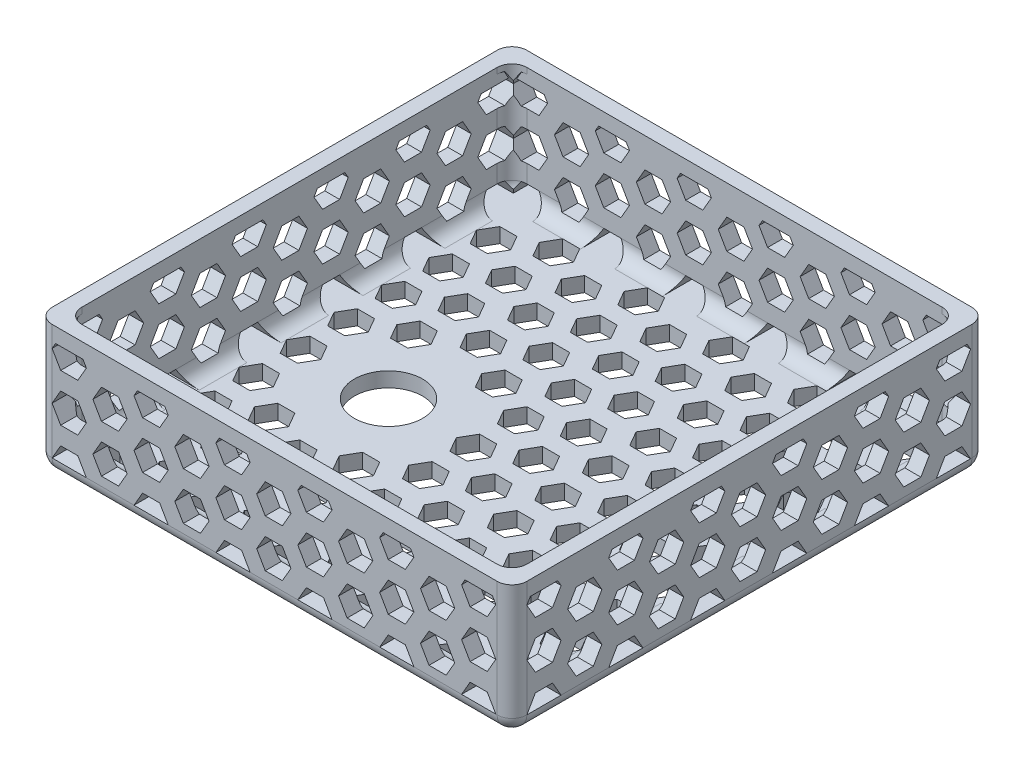
from build123d import *

# Parameters (mm, degrees)
SKETCH1_W           = 80
SKETCH1_H           = 80
BOSS_EXTRUDE1_DEPTH = 22
SKETCH2_W           = 75
SKETCH2_H           = 75
CUT_EXTRUDE1_DEPTH  = 19.5
FILLET1_R           = 2.5
SKETCH10_R          = 5.75
CUT_EXTRUDE5_DEPTH  = 2.5
CUT_EXTRUDE6_DEPTH  = 5
SKETCH12_W          = 75
SKETCH12_H          = 2.5
BOSS_EXTRUDE2_DEPTH = 2.5
CIRPATTERN9_COUNT   = 4


with BuildPart() as part:
    # Sketch1 → Boss-Extrude1 (new body)
    with BuildSketch(Plane(origin=(0, 0, 0), x_dir=(1, 0, 0), z_dir=(0, 1, 0))):
        with Locations((40, 40)):
            Rectangle(SKETCH1_W, SKETCH1_H)
    extrude(amount=BOSS_EXTRUDE1_DEPTH)

    # Sketch2 → Cut-Extrude1 (cut)
    with BuildSketch(Plane(origin=(0, 22, 0), x_dir=(1, 0, 0), z_dir=(0, 1, 0))):
        with Locations((40, 40)):
            Rectangle(SKETCH2_W, SKETCH2_H)
    extrude(amount=-CUT_EXTRUDE1_DEPTH, mode=Mode.SUBTRACT)

    # Fillet1
    fillet1_edges = [part.edges().sort_by_distance(p)[0] for p in [
        (2.5, 2.5, -40),
        (2.5, 12.25, -2.5),
        (40, 2.5, -77.5),
        (2.5, 12.25, -77.5),
        (77.5, 2.5, -40),
        (77.5, 12.25, -77.5),
        (40, 2.5, -2.5),
        (77.5, 12.25, -2.5),
        (40, 0, -80),
        (80, 0, -40),
        (40, 0, 0),
        (0, 0, -40),
        (0, 11, -80),
        (80, 11, -80),
        (80, 11, 0),
        (0, 11, 0),
    ]]
    fillet(fillet1_edges, radius=FILLET1_R)

    # Sketch10 → Cut-Extrude5 (cut)
    with BuildSketch(Plane(origin=(0, 2.5, 0), x_dir=(1, 0, 0), z_dir=(0, 1, 0))):
        with Locations(Location((22.186751346, 37, 0), (0, 0, 270))):
            Circle(SKETCH10_R)
        Polygon((10.773502692, 5), (9.330127019, 7.5), (6.443375673, 7.5), (5, 5), align=None)
        Polygon((25.073502692, 5), (23.630127019, 7.5), (20.743375673, 7.5), (19.3, 5), align=None)
        Polygon((13.526497308, 6), (16.413248654, 6), (17.856624327, 8.5), (16.413248654, 11), (13.526497308, 11), (12.083121635, 8.5), align=None)
        Polygon((39.373502692, 5), (37.930127019, 7.5), (35.043375673, 7.5), (33.6, 5), align=None)
        Polygon((27.826497308, 6), (30.713248654, 6), (32.156624327, 8.5), (30.713248654, 11), (27.826497308, 11), (26.383121635, 8.5), align=None)
        Polygon((53.673502692, 5), (52.230127019, 7.5), (49.343375673, 7.5), (47.9, 5), align=None)
        Polygon((42.126497308, 6), (45.013248654, 6), (46.456624327, 8.5), (45.013248654, 11), (42.126497308, 11), (40.683121635, 8.5), align=None)
        Polygon((67.973502692, 5), (66.530127019, 7.5), (63.643375673, 7.5), (62.2, 5), align=None)
        Polygon((56.426497308, 6), (59.313248654, 6), (60.756624327, 8.5), (59.313248654, 11), (56.426497308, 11), (54.983121635, 8.5), align=None)
        Polygon((70.726497308, 6), (73.613248654, 6), (75.056624327, 8.5), (73.613248654, 11), (70.726497308, 11), (69.283121635, 8.5), align=None)
        Polygon((23.630127019, 10.5), (25.073502692, 13), (23.630127019, 15.5), (20.743375673, 15.5), (19.3, 13), (20.743375673, 10.5), align=None)
        Polygon((13.526497308, 14), (16.413248654, 14), (17.856624327, 16.5), (16.413248654, 19), (13.526497308, 19), (12.083121635, 16.5), align=None)
        Polygon((37.930127019, 10.5), (39.373502692, 13), (37.930127019, 15.5), (35.043375673, 15.5), (33.6, 13), (35.043375673, 10.5), align=None)
        Polygon((27.826497308, 14), (30.713248654, 14), (32.156624327, 16.5), (30.713248654, 19), (27.826497308, 19), (26.383121635, 16.5), align=None)
        Polygon((52.230127019, 10.5), (53.673502692, 13), (52.230127019, 15.5), (49.343375673, 15.5), (47.9, 13), (49.343375673, 10.5), align=None)
        Polygon((42.126497308, 14), (45.013248654, 14), (46.456624327, 16.5), (45.013248654, 19), (42.126497308, 19), (40.683121635, 16.5), align=None)
        Polygon((66.530127019, 10.5), (67.973502692, 13), (66.530127019, 15.5), (63.643375673, 15.5), (62.2, 13), (63.643375673, 10.5), align=None)
        Polygon((56.426497308, 14), (59.313248654, 14), (60.756624327, 16.5), (59.313248654, 19), (56.426497308, 19), (54.983121635, 16.5), align=None)
        Polygon((70.726497308, 14), (73.613248654, 14), (75.056624327, 16.5), (73.613248654, 19), (70.726497308, 19), (69.283121635, 16.5), align=None)
        Polygon((23.630127019, 18.5), (25.073502692, 21), (23.630127019, 23.5), (20.743375673, 23.5), (19.3, 21), (20.743375673, 18.5), align=None)
        Polygon((13.526497308, 22), (16.413248654, 22), (17.856624327, 24.5), (16.413248654, 27), (13.526497308, 27), (12.083121635, 24.5), align=None)
        Polygon((37.930127019, 18.5), (39.373502692, 21), (37.930127019, 23.5), (35.043375673, 23.5), (33.6, 21), (35.043375673, 18.5), align=None)
        Polygon((27.826497308, 22), (30.713248654, 22), (32.156624327, 24.5), (30.713248654, 27), (27.826497308, 27), (26.383121635, 24.5), align=None)
        Polygon((52.230127019, 18.5), (53.673502692, 21), (52.230127019, 23.5), (49.343375673, 23.5), (47.9, 21), (49.343375673, 18.5), align=None)
        Polygon((42.126497308, 22), (45.013248654, 22), (46.456624327, 24.5), (45.013248654, 27), (42.126497308, 27), (40.683121635, 24.5), align=None)
        Polygon((66.530127019, 18.5), (67.973502692, 21), (66.530127019, 23.5), (63.643375673, 23.5), (62.2, 21), (63.643375673, 18.5), align=None)
        Polygon((56.426497308, 22), (59.313248654, 22), (60.756624327, 24.5), (59.313248654, 27), (56.426497308, 27), (54.983121635, 24.5), align=None)
        Polygon((70.726497308, 22), (73.613248654, 22), (75.056624327, 24.5), (73.613248654, 27), (70.726497308, 27), (69.283121635, 24.5), align=None)
        Polygon((37.930127019, 26.5), (39.373502692, 29), (37.930127019, 31.5), (35.043375673, 31.5), (33.6, 29), (35.043375673, 26.5), align=None)
        Polygon((52.230127019, 26.5), (53.673502692, 29), (52.230127019, 31.5), (49.343375673, 31.5), (47.9, 29), (49.343375673, 26.5), align=None)
        Polygon((42.126497308, 30), (45.013248654, 30), (46.456624327, 32.5), (45.013248654, 35), (42.126497308, 35), (40.683121635, 32.5), align=None)
        Polygon((66.530127019, 26.5), (67.973502692, 29), (66.530127019, 31.5), (63.643375673, 31.5), (62.2, 29), (63.643375673, 26.5), align=None)
        Polygon((56.426497308, 30), (59.313248654, 30), (60.756624327, 32.5), (59.313248654, 35), (56.426497308, 35), (54.983121635, 32.5), align=None)
        Polygon((70.726497308, 30), (73.613248654, 30), (75.056624327, 32.5), (73.613248654, 35), (70.726497308, 35), (69.283121635, 32.5), align=None)
        Polygon((37.930127019, 34.5), (39.373502692, 37), (37.930127019, 39.5), (35.043375673, 39.5), (33.6, 37), (35.043375673, 34.5), align=None)
        Polygon((52.230127019, 34.5), (53.673502692, 37), (52.230127019, 39.5), (49.343375673, 39.5), (47.9, 37), (49.343375673, 34.5), align=None)
        Polygon((42.126497308, 38), (45.013248654, 38), (46.456624327, 40.5), (45.013248654, 43), (42.126497308, 43), (40.683121635, 40.5), align=None)
        Polygon((66.530127019, 34.5), (67.973502692, 37), (66.530127019, 39.5), (63.643375673, 39.5), (62.2, 37), (63.643375673, 34.5), align=None)
        Polygon((56.426497308, 38), (59.313248654, 38), (60.756624327, 40.5), (59.313248654, 43), (56.426497308, 43), (54.983121635, 40.5), align=None)
        Polygon((70.726497308, 38), (73.613248654, 38), (75.056624327, 40.5), (73.613248654, 43), (70.726497308, 43), (69.283121635, 40.5), align=None)
        Polygon((13.526497308, 46), (16.413248654, 46), (17.856624327, 48.5), (16.413248654, 51), (13.526497308, 51), (12.083121635, 48.5), align=None)
        Polygon((37.930127019, 42.5), (39.373502692, 45), (37.930127019, 47.5), (35.043375673, 47.5), (33.6, 45), (35.043375673, 42.5), align=None)
        Polygon((27.826497308, 46), (30.713248654, 46), (32.156624327, 48.5), (30.713248654, 51), (27.826497308, 51), (26.383121635, 48.5), align=None)
        Polygon((52.230127019, 42.5), (53.673502692, 45), (52.230127019, 47.5), (49.343375673, 47.5), (47.9, 45), (49.343375673, 42.5), align=None)
        Polygon((42.126497308, 46), (45.013248654, 46), (46.456624327, 48.5), (45.013248654, 51), (42.126497308, 51), (40.683121635, 48.5), align=None)
        Polygon((66.530127019, 42.5), (67.973502692, 45), (66.530127019, 47.5), (63.643375673, 47.5), (62.2, 45), (63.643375673, 42.5), align=None)
        Polygon((56.426497308, 46), (59.313248654, 46), (60.756624327, 48.5), (59.313248654, 51), (56.426497308, 51), (54.983121635, 48.5), align=None)
        Polygon((70.726497308, 46), (73.613248654, 46), (75.056624327, 48.5), (73.613248654, 51), (70.726497308, 51), (69.283121635, 48.5), align=None)
        Polygon((23.630127019, 50.5), (25.073502692, 53), (23.630127019, 55.5), (20.743375673, 55.5), (19.3, 53), (20.743375673, 50.5), align=None)
        Polygon((13.526497308, 54), (16.413248654, 54), (17.856624327, 56.5), (16.413248654, 59), (13.526497308, 59), (12.083121635, 56.5), align=None)
        Polygon((37.930127019, 50.5), (39.373502692, 53), (37.930127019, 55.5), (35.043375673, 55.5), (33.6, 53), (35.043375673, 50.5), align=None)
        Polygon((27.826497308, 54), (30.713248654, 54), (32.156624327, 56.5), (30.713248654, 59), (27.826497308, 59), (26.383121635, 56.5), align=None)
        Polygon((52.230127019, 50.5), (53.673502692, 53), (52.230127019, 55.5), (49.343375673, 55.5), (47.9, 53), (49.343375673, 50.5), align=None)
        Polygon((42.126497308, 54), (45.013248654, 54), (46.456624327, 56.5), (45.013248654, 59), (42.126497308, 59), (40.683121635, 56.5), align=None)
        Polygon((66.530127019, 50.5), (67.973502692, 53), (66.530127019, 55.5), (63.643375673, 55.5), (62.2, 53), (63.643375673, 50.5), align=None)
        Polygon((56.426497308, 54), (59.313248654, 54), (60.756624327, 56.5), (59.313248654, 59), (56.426497308, 59), (54.983121635, 56.5), align=None)
        Polygon((70.726497308, 54), (73.613248654, 54), (75.056624327, 56.5), (73.613248654, 59), (70.726497308, 59), (69.283121635, 56.5), align=None)
        Polygon((23.630127019, 58.5), (25.073502692, 61), (23.630127019, 63.5), (20.743375673, 63.5), (19.3, 61), (20.743375673, 58.5), align=None)
        Polygon((13.526497308, 62), (16.413248654, 62), (17.856624327, 64.5), (16.413248654, 67), (13.526497308, 67), (12.083121635, 64.5), align=None)
        Polygon((37.930127019, 58.5), (39.373502692, 61), (37.930127019, 63.5), (35.043375673, 63.5), (33.6, 61), (35.043375673, 58.5), align=None)
        Polygon((27.826497308, 62), (30.713248654, 62), (32.156624327, 64.5), (30.713248654, 67), (27.826497308, 67), (26.383121635, 64.5), align=None)
        Polygon((52.230127019, 58.5), (53.673502692, 61), (52.230127019, 63.5), (49.343375673, 63.5), (47.9, 61), (49.343375673, 58.5), align=None)
        Polygon((42.126497308, 62), (45.013248654, 62), (46.456624327, 64.5), (45.013248654, 67), (42.126497308, 67), (40.683121635, 64.5), align=None)
        Polygon((66.530127019, 58.5), (67.973502692, 61), (66.530127019, 63.5), (63.643375673, 63.5), (62.2, 61), (63.643375673, 58.5), align=None)
        Polygon((56.426497308, 62), (59.313248654, 62), (60.756624327, 64.5), (59.313248654, 67), (56.426497308, 67), (54.983121635, 64.5), align=None)
        Polygon((70.726497308, 62), (73.613248654, 62), (75.056624327, 64.5), (73.613248654, 67), (70.726497308, 67), (69.283121635, 64.5), align=None)
        Polygon((23.630127019, 66.5), (25.073502692, 69), (23.630127019, 71.5), (20.743375673, 71.5), (19.3, 69), (20.743375673, 66.5), align=None)
        Polygon((13.526497308, 70), (16.413248654, 70), (17.856624327, 72.5), (16.413248654, 75), (13.526497308, 75), (12.083121635, 72.5), align=None)
        Polygon((37.930127019, 66.5), (39.373502692, 69), (37.930127019, 71.5), (35.043375673, 71.5), (33.6, 69), (35.043375673, 66.5), align=None)
        Polygon((27.826497308, 70), (30.713248654, 70), (32.156624327, 72.5), (30.713248654, 75), (27.826497308, 75), (26.383121635, 72.5), align=None)
        Polygon((52.230127019, 66.5), (53.673502692, 69), (52.230127019, 71.5), (49.343375673, 71.5), (47.9, 69), (49.343375673, 66.5), align=None)
        Polygon((42.126497308, 70), (45.013248654, 70), (46.456624327, 72.5), (45.013248654, 75), (42.126497308, 75), (40.683121635, 72.5), align=None)
        Polygon((66.530127019, 66.5), (67.973502692, 69), (66.530127019, 71.5), (63.643375673, 71.5), (62.2, 69), (63.643375673, 66.5), align=None)
        Polygon((56.426497308, 70), (59.313248654, 70), (60.756624327, 72.5), (59.313248654, 75), (56.426497308, 75), (54.983121635, 72.5), align=None)
        Polygon((70.726497308, 70), (73.613248654, 70), (75.056624327, 72.5), (73.613248654, 75), (70.726497308, 75), (69.283121635, 72.5), align=None)
        Polygon((9.330127019, 10.5), (10.773502692, 13), (9.330127019, 15.5), (6.443375673, 15.5), (5, 13), (6.443375673, 10.5), align=None)
        Polygon((9.330127019, 18.5), (10.773502692, 21), (9.330127019, 23.5), (6.443375673, 23.5), (5, 21), (6.443375673, 18.5), align=None)
        Polygon((9.330127019, 26.5), (10.773502692, 29), (9.330127019, 31.5), (6.443375673, 31.5), (5, 29), (6.443375673, 26.5), align=None)
        Polygon((9.330127019, 34.5), (10.773502692, 37), (9.330127019, 39.5), (6.443375673, 39.5), (5, 37), (6.443375673, 34.5), align=None)
        Polygon((9.330127019, 42.5), (10.773502692, 45), (9.330127019, 47.5), (6.443375673, 47.5), (5, 45), (6.443375673, 42.5), align=None)
        Polygon((9.330127019, 50.5), (10.773502692, 53), (9.330127019, 55.5), (6.443375673, 55.5), (5, 53), (6.443375673, 50.5), align=None)
        Polygon((9.330127019, 58.5), (10.773502692, 61), (9.330127019, 63.5), (6.443375673, 63.5), (5, 61), (6.443375673, 58.5), align=None)
        Polygon((9.330127019, 66.5), (10.773502692, 69), (9.330127019, 71.5), (6.443375673, 71.5), (5, 69), (6.443375673, 66.5), align=None)
    extrude(amount=-CUT_EXTRUDE5_DEPTH, mode=Mode.SUBTRACT)

    # Sketch11 → Cut-Extrude6 (cut)
    with BuildSketch(Plane.ZY):
        Polygon((-71.726497308, 2.5), (-73.169872981, 5), (-76.056624327, 5), (-77.5, 2.5), align=None)
        Polygon((-59.369872981, 5), (-62.256624327, 5), (-63.7, 2.5), (-57.926497308, 2.5), align=None)
        Polygon((-66.298076211, 4), (-64.854700538, 6.5), (-66.298076211, 9), (-69.184827557, 9), (-70.62820323, 6.5), (-69.184827557, 4), align=None)
        Polygon((-45.569872981, 5), (-48.456624327, 5), (-49.9, 2.5), (-44.126497308, 2.5), align=None)
        Polygon((-52.498076211, 4), (-51.054700538, 6.5), (-52.498076211, 9), (-55.384827557, 9), (-56.82820323, 6.5), (-55.384827557, 4), align=None)
        Polygon((-31.769872981, 5), (-34.656624327, 5), (-36.1, 2.5), (-30.326497308, 2.5), align=None)
        Polygon((-38.698076211, 4), (-37.254700538, 6.5), (-38.698076211, 9), (-41.584827557, 9), (-43.02820323, 6.5), (-41.584827557, 4), align=None)
        Polygon((-17.969872981, 5), (-20.856624327, 5), (-22.3, 2.5), (-16.526497308, 2.5), align=None)
        Polygon((-24.898076211, 4), (-23.454700538, 6.5), (-24.898076211, 9), (-27.784827557, 9), (-29.22820323, 6.5), (-27.784827557, 4), align=None)
        Polygon((-4.169872981, 5), (-7.056624327, 5), (-8.5, 2.5), (-2.726497308, 2.5), align=None)
        Polygon((-11.098076211, 4), (-9.654700538, 6.5), (-11.098076211, 9), (-13.984827557, 9), (-15.42820323, 6.5), (-13.984827557, 4), align=None)
        Polygon((-59.369872981, 13), (-62.256624327, 13), (-63.7, 10.5), (-62.256624327, 8), (-59.369872981, 8), (-57.926497308, 10.5), align=None)
        Polygon((-66.298076211, 12), (-64.854700538, 14.5), (-66.298076211, 17), (-69.184827557, 17), (-70.62820323, 14.5), (-69.184827557, 12), align=None)
        Polygon((-45.569872981, 13), (-48.456624327, 13), (-49.9, 10.5), (-48.456624327, 8), (-45.569872981, 8), (-44.126497308, 10.5), align=None)
        Polygon((-52.498076211, 12), (-51.054700538, 14.5), (-52.498076211, 17), (-55.384827557, 17), (-56.82820323, 14.5), (-55.384827557, 12), align=None)
        Polygon((-31.769872981, 13), (-34.656624327, 13), (-36.1, 10.5), (-34.656624327, 8), (-31.769872981, 8), (-30.326497308, 10.5), align=None)
        Polygon((-38.698076211, 12), (-37.254700538, 14.5), (-38.698076211, 17), (-41.584827557, 17), (-43.02820323, 14.5), (-41.584827557, 12), align=None)
        Polygon((-17.969872981, 13), (-20.856624327, 13), (-22.3, 10.5), (-20.856624327, 8), (-17.969872981, 8), (-16.526497308, 10.5), align=None)
        Polygon((-24.898076211, 12), (-23.454700538, 14.5), (-24.898076211, 17), (-27.784827557, 17), (-29.22820323, 14.5), (-27.784827557, 12), align=None)
        Polygon((-4.169872981, 13), (-7.056624327, 13), (-8.5, 10.5), (-7.056624327, 8), (-4.169872981, 8), (-2.726497308, 10.5), align=None)
        Polygon((-11.098076211, 12), (-9.654700538, 14.5), (-11.098076211, 17), (-13.984827557, 17), (-15.42820323, 14.5), (-13.984827557, 12), align=None)
        Polygon((-59.369872981, 21), (-62.256624327, 21), (-63.7, 18.5), (-62.256624327, 16), (-59.369872981, 16), (-57.926497308, 18.5), align=None)
        Polygon((-66.298076211, 20), (-64.854700538, 22.5), (-70.62820323, 22.5), (-69.184827557, 20), align=None)
        Polygon((-45.569872981, 21), (-48.456624327, 21), (-49.9, 18.5), (-48.456624327, 16), (-45.569872981, 16), (-44.126497308, 18.5), align=None)
        Polygon((-52.498076211, 20), (-51.054700538, 22.5), (-56.82820323, 22.5), (-55.384827557, 20), align=None)
        Polygon((-31.769872981, 21), (-34.656624327, 21), (-36.1, 18.5), (-34.656624327, 16), (-31.769872981, 16), (-30.326497308, 18.5), align=None)
        Polygon((-38.698076211, 20), (-37.254700538, 22.5), (-43.02820323, 22.5), (-41.584827557, 20), align=None)
        Polygon((-17.969872981, 21), (-20.856624327, 21), (-22.3, 18.5), (-20.856624327, 16), (-17.969872981, 16), (-16.526497308, 18.5), align=None)
        Polygon((-24.898076211, 20), (-23.454700538, 22.5), (-29.22820323, 22.5), (-27.784827557, 20), align=None)
        Polygon((-4.169872981, 21), (-7.056624327, 21), (-8.5, 18.5), (-7.056624327, 16), (-4.169872981, 16), (-2.726497308, 18.5), align=None)
        Polygon((-11.098076211, 20), (-9.654700538, 22.5), (-15.42820323, 22.5), (-13.984827557, 20), align=None)
        Polygon((-73.169872981, 13), (-76.056624327, 13), (-77.5, 10.5), (-76.056624327, 8), (-73.169872981, 8), (-71.726497308, 10.5), align=None)
        Polygon((-73.169872981, 21), (-76.056624327, 21), (-77.5, 18.5), (-76.056624327, 16), (-73.169872981, 16), (-71.726497308, 18.5), align=None)
    cut_extrude6 = extrude(amount=-CUT_EXTRUDE6_DEPTH, mode=Mode.SUBTRACT)

    # Sketch12 → Boss-Extrude2 (add)
    with BuildSketch(Plane.ZY):
        with Locations((-40, 20.75)):
            Rectangle(SKETCH12_W, SKETCH12_H)
    boss_extrude2 = extrude(amount=-BOSS_EXTRUDE2_DEPTH)

    # CirPattern9: Cut-Extrude6, Boss-Extrude2 ×4 about axis
    cirpattern9_axis = Axis((40, 0, -40), (0, 1, 0))
    add([cut_extrude6.rotate(cirpattern9_axis, i * 360 / CIRPATTERN9_COUNT) for i in range(1, CIRPATTERN9_COUNT)], mode=Mode.SUBTRACT)
    add([boss_extrude2.rotate(cirpattern9_axis, i * 360 / CIRPATTERN9_COUNT) for i in range(1, CIRPATTERN9_COUNT)])


solid = part.part
